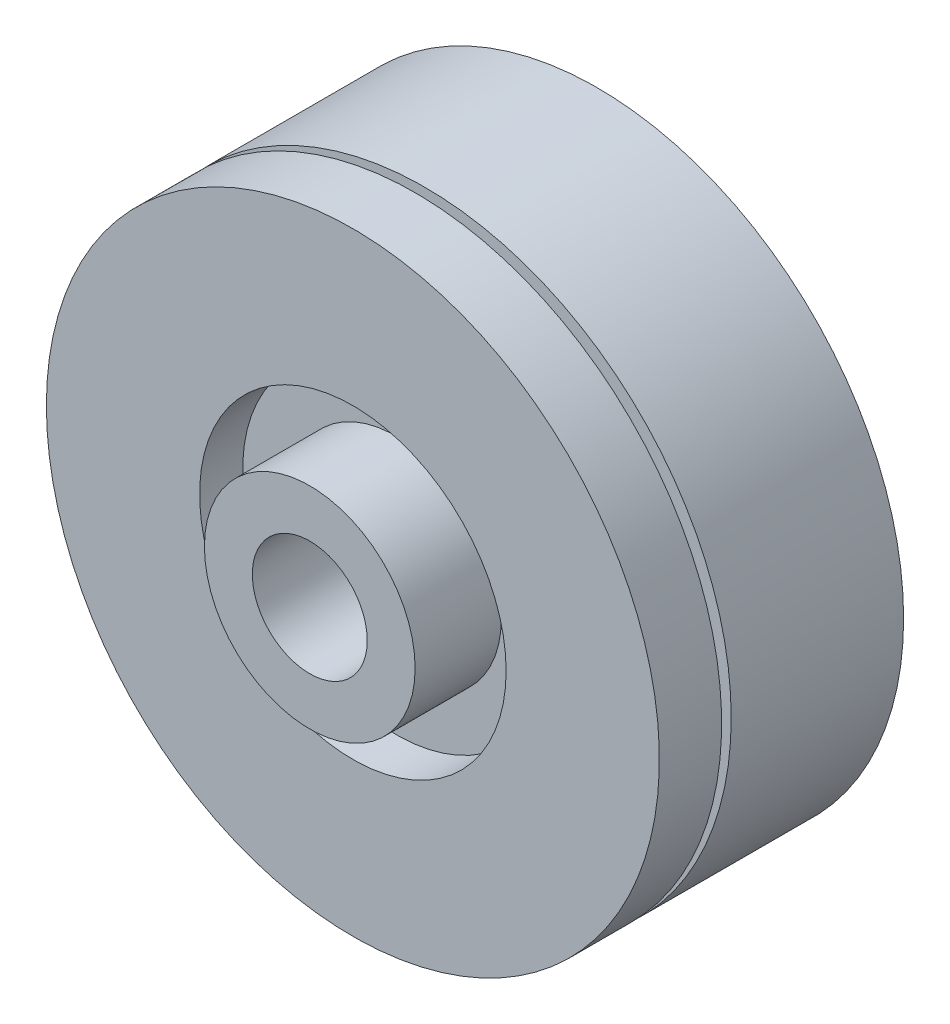
from build123d import *

# Parameters (mm, degrees)
SKETCH_1_R          = 16
EXTRUDE_1_DEPTH     = 9
SKETCH_2_R          = 6
EXTRUDE_2_DEPTH     = 0.5
SKETCH_3_R          = 16
EXTRUDE_3_DEPTH     = 3.25
SKETCH_4_R          = 5.5
EXTRUDE_4_DEPTH     = 2.25
SKETCH_5_R          = 3
CUT_EXTRUDE_1_DEPTH = 26.25
CUT_EXTRUDE_START   = -2.25
SKETCH_6_R          = 8
SKETCH_6_R_2        = 5.5
CUT_EXTRUDE_2_DEPTH = 2.25
SKETCH_7_R          = 1
CUT_EXTRUDE_3_DEPTH = 6


with BuildPart() as part:
    # 草图1 → 凸台-拉伸1 (new body)
    with BuildSketch(Plane.XY):
        Circle(SKETCH_1_R)
    extrude(amount=EXTRUDE_1_DEPTH)

    # 草图2 → 凸台-拉伸2 (add)
    with BuildSketch(Plane.XY.offset(9)):
        Circle(SKETCH_2_R)
    extrude(amount=EXTRUDE_2_DEPTH)

    # 草图3 → 凸台-拉伸3 (add)
    with BuildSketch(Plane.XY.offset(9.5)):
        Circle(SKETCH_3_R)
    extrude(amount=EXTRUDE_3_DEPTH)

    # 草图4 → 凸台-拉伸4 (add)
    with BuildSketch(Plane.XY.offset(12.75)):
        Circle(SKETCH_4_R)
    extrude(amount=EXTRUDE_4_DEPTH)

    # 草图5 → 切除-拉伸1 (cut)
    with BuildSketch(Plane.XY.offset(15)):
        Circle(SKETCH_5_R)
    extrude(amount=-CUT_EXTRUDE_1_DEPTH, mode=Mode.SUBTRACT)

    # 草图6 → 切除-拉伸2 (cut)
    with BuildSketch(Plane.XY.offset(12.75).offset(CUT_EXTRUDE_START)):
        Circle(SKETCH_6_R)
        Circle(SKETCH_6_R_2, mode=Mode.SUBTRACT)
    extrude(amount=CUT_EXTRUDE_2_DEPTH, mode=Mode.SUBTRACT)

    # 草图7 → 切除-拉伸3 (cut)
    with BuildSketch(Plane(origin=(0, 0, 0), x_dir=(-1, 0, 0), z_dir=(0, 0, -1))):
        with Locations((8.660254038, 5)):
            Circle(SKETCH_7_R)
        with Locations((-8.660254038, 5)):
            Circle(SKETCH_7_R)
        with Locations((0, -10)):
            Circle(SKETCH_7_R)
    extrude(amount=-CUT_EXTRUDE_3_DEPTH, mode=Mode.SUBTRACT)


solid = part.part
